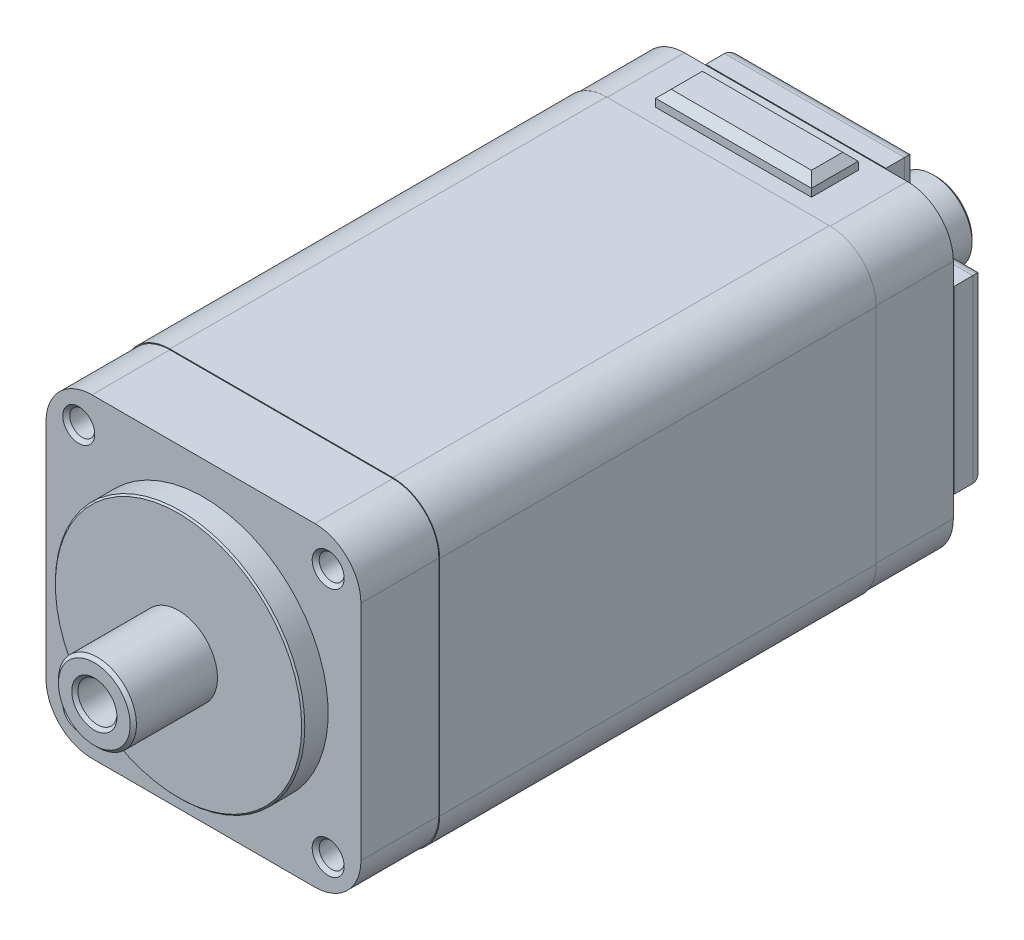
from build123d import *

# Parameters (mm, degrees)
MAIN_SKETCH_W                     = 38
MAIN_SKETCH_H                     = 20.3
MAIN_BODY_EXTRUDE_DEPTH           = 10.15
SKETCH2_R                         = 8
BOSS_EXTRUDE2_DEPTH               = 1.6
SKETCH3_R                         = 2.5
BOSS_EXTRUDE3_DEPTH               = 5.4
CUT_EXTRUDE1_DEPTH                = 48.233939069
CUT_EXTRUDE1_DEPTH_BACK           = 48.233939069
SKETCH4_R                         = 1.25
CHAMFER1_SIZE                     = 0.2
CHAMFER2_SIZE                     = 0.2
SKETCH6_R                         = 2.5
SKETCH6_R_2                       = 1.25
BOSS_EXTRUDE4_DEPTH               = 9
MOUNTING_HOLE_LOCATION_SKETCH_R   = 0.5
MOUNTING_HOLE_CUT_LOCATIONS_DEPTH = 2
CUT_EXTRUDE3_START                = -2
SKETCH8_R                         = 0.5
CUT_EXTRUDE3_DEPTH                = 2
FILLET1_R                         = 3
SKETCH10_R                        = 2.6
BOSS_EXTRUDE5_DEPTH               = 2
FILLET2_R                         = 0.8
SKETCH13_W                        = 10
SKETCH13_H                        = 3
BOSS_EXTRUDE7_DEPTH               = 1
CHAMFER3_SIZE                     = 0.5
CUT_EXTRUDE5_DEPTH                = 5
CUT_EXTRUDE6_START                = -5
CUT_EXTRUDE6_DEPTH                = 5
CHAMFER4_SIZE                     = 0.2
CHAMFER5_SIZE                     = 0.1


# Read off the part's stored shape, not the designer's step: M2 Tapped Hole1
with BuildPart() as part:
    # Main Sketch → Main Body Extrude (new, symmetric)
    with BuildSketch(Plane(origin=(0, 0, 0), x_dir=(0, 0, -1), z_dir=(1, 0, 0))):
        Rectangle(MAIN_SKETCH_W, MAIN_SKETCH_H)
    extrude(amount=MAIN_BODY_EXTRUDE_DEPTH, both=True)

    # Sketch2 → Boss-Extrude2 (add)
    with BuildSketch(Plane.XY.offset(19)):
        with Locations(Location((0, 0, 0), (0, 0, 180))):
            Circle(SKETCH2_R)
    extrude(amount=BOSS_EXTRUDE2_DEPTH)

    # Sketch3 → Boss-Extrude3 (add)
    with BuildSketch(Plane.XY.offset(20.6)):
        with Locations(Location((0, 0, 0), (0, 0, 180))):
            Circle(SKETCH3_R)
    extrude(amount=BOSS_EXTRUDE3_DEPTH)

    # Sketch4 → Cut-Extrude1 (cut, two sides: drawn at the far end of the back side and taken through both)
    with BuildSketch(Plane.XY.offset(26).offset(-CUT_EXTRUDE1_DEPTH_BACK)):
        Circle(SKETCH4_R)
    extrude(amount=CUT_EXTRUDE1_DEPTH + CUT_EXTRUDE1_DEPTH_BACK, mode=Mode.SUBTRACT)

    # Chamfer1
    chamfer1_edges = [part.edges().sort_by_distance(p)[0] for p in [
        (-1.25, 0, 26),
    ]]
    chamfer(chamfer1_edges, length=CHAMFER1_SIZE)

    # Chamfer2
    chamfer2_edges = [part.edges().sort_by_distance(p)[0] for p in [
        (2.5, 0, 26),
    ]]
    chamfer(chamfer2_edges, length=CHAMFER2_SIZE)

    # Sketch6 → Boss-Extrude4 (add)
    with BuildSketch(Plane(origin=(0, 0, -19), x_dir=(-1, 0, 0), z_dir=(0, 0, -1))):
        Circle(SKETCH6_R)
        with Locations(Location((0, 0, 0), (0, 0, 180))):
            Circle(SKETCH6_R_2, mode=Mode.SUBTRACT)
    extrude(amount=BOSS_EXTRUDE4_DEPTH)

    # Mounting Hole Location Sketch → Mounting Hole Cut Locations (cut)
    with BuildSketch(Plane.XY.offset(19)):
        with Locations((-8, 8)):
            Circle(MOUNTING_HOLE_LOCATION_SKETCH_R)
        with Locations((8, 8)):
            Circle(MOUNTING_HOLE_LOCATION_SKETCH_R)
        with Locations((8, -8)):
            Circle(MOUNTING_HOLE_LOCATION_SKETCH_R)
        with Locations((-8, -8)):
            Circle(MOUNTING_HOLE_LOCATION_SKETCH_R)
    extrude(amount=-MOUNTING_HOLE_CUT_LOCATIONS_DEPTH, mode=Mode.SUBTRACT)

    # Sketch8 → Cut-Extrude3 (cut)
    with BuildSketch(Plane(origin=(0, 0, -19), x_dir=(-1, 0, 0), z_dir=(0, 0, -1)).offset(CUT_EXTRUDE3_START)):
        with Locations(Location((8, -8, 0), (0, 0, 180))):
            Circle(SKETCH8_R)
        with Locations(Location((-8, -8, 0), (0, 0, 180))):
            Circle(SKETCH8_R)
        with Locations(Location((-8, 8, 0), (0, 0, 180))):
            Circle(SKETCH8_R)
        with Locations(Location((8, 8, 0), (0, 0, 180))):
            Circle(SKETCH8_R)
    extrude(amount=CUT_EXTRUDE3_DEPTH, mode=Mode.SUBTRACT)

    # M2 Tapped Hole1 outline → M2 Tapped Hole1 (revolve, cut)
    with BuildSketch(Plane(origin=(-8, 8, 0), x_dir=(1, 0, 0), z_dir=(0, -1, 0))):
        Polygon((0, -15.519311505), (0, -17), (0.5, -17), (0.5, -19), (1.025, -19), (0.8, -18.775), (0.8, -16), align=None)
        Polygon((0, 17), (0, 15.519311505), (0.8, 16), (0.8, 18.775), (1.025, 19), (0.5, 19), (0.5, 17), align=None)
    revolve(axis=Axis((-8, 8, 0), (0, 0, 1)), mode=Mode.SUBTRACT)

    # M2 Tapped Hole1 2 outline → M2 Tapped Hole1 2 (revolve, cut)
    with BuildSketch(Plane(origin=(8, -8, 0), x_dir=(1, 0, 0), z_dir=(0, -1, 0))):
        Polygon((0, -15.519311505), (0, -17), (0.5, -17), (0.5, -19), (1.025, -19), (0.8, -18.775), (0.8, -16), align=None)
        Polygon((0, 17), (0, 15.519311505), (0.8, 16), (0.8, 18.775), (1.025, 19), (0.5, 19), (0.5, 17), align=None)
    revolve(axis=Axis((8, -8, 0), (0, 0, 1)), mode=Mode.SUBTRACT)

    # M2 Tapped Hole1 3 outline → M2 Tapped Hole1 3 (revolve, cut)
    with BuildSketch(Plane(origin=(8, 8, 0), x_dir=(1, 0, 0), z_dir=(0, -1, 0))):
        Polygon((0, -15.519311505), (0, -17), (0.5, -17), (0.5, -19), (1.025, -19), (0.8, -18.775), (0.8, -16), align=None)
        Polygon((0, 17), (0, 15.519311505), (0.8, 16), (0.8, 18.775), (1.025, 19), (0.5, 19), (0.5, 17), align=None)
    revolve(axis=Axis((8, 8, 0), (0, 0, 1)), mode=Mode.SUBTRACT)

    # M2 Tapped Hole1 4 outline → M2 Tapped Hole1 4 (revolve, cut)
    with BuildSketch(Plane(origin=(-8, -8, 0), x_dir=(1, 0, 0), z_dir=(0, -1, 0))):
        Polygon((0, -15.519311505), (0, -17), (0.5, -17), (0.5, -19), (1.025, -19), (0.8, -18.775), (0.8, -16), align=None)
        Polygon((0, 17), (0, 15.519311505), (0.8, 16), (0.8, 18.775), (1.025, 19), (0.5, 19), (0.5, 17), align=None)
    revolve(axis=Axis((-8, -8, 0), (0, 0, 1)), mode=Mode.SUBTRACT)

    # Fillet1
    fillet1_edges = [part.edges().sort_by_distance(p)[0] for p in [
        (10.15, -10.15, 0),
        (-10.15, -10.15, 0),
        (-10.15, 10.15, 0),
        (10.15, 10.15, 0),
    ]]
    fillet(fillet1_edges, radius=FILLET1_R)

    # Sketch13 → Boss-Extrude7 (add)
    with BuildSketch(Plane(origin=(0, 10.15, 0), x_dir=(1, 0, 0), z_dir=(0, 1, 0))):
        with Locations((0, 16.5)):
            Rectangle(SKETCH13_W, SKETCH13_H)
    extrude(amount=BOSS_EXTRUDE7_DEPTH)

    # Chamfer3
    chamfer3_edges = [part.edges().sort_by_distance(p)[0] for p in [
        (-5, 11.15, -16.5),
        (0, 11.15, -15),
        (5, 11.15, -16.5),
        (0, 11.15, -18),
    ]]
    chamfer(chamfer3_edges, length=CHAMFER3_SIZE)

    # Sketch14 → Cut-Extrude5 (cut)
    with BuildSketch(Plane.XY.offset(19)):
        with BuildLine():
            Line((10.15, -7.15), (10.15, 7.15))
            ThreePointArc((10.15, 7.15), (9.271320344, 9.271320344), (7.15, 10.15))
            Line((7.15, 10.15), (-7.15, 10.15))
            ThreePointArc((-7.15, 10.15), (-9.271320344, 9.271320344), (-10.15, 7.15))
            Line((-10.15, 7.15), (-10.15, -7.15))
            ThreePointArc((-10.15, -7.15), (-9.271320344, -9.271320344), (-7.15, -10.15))
            Line((-7.15, -10.15), (7.15, -10.15))
            ThreePointArc((7.15, -10.15), (9.271320344, -9.271320344), (10.15, -7.15))
        make_face()
        with BuildLine():
            Line((10.1, -7.15), (10.1, 7.15))
            ThreePointArc((10.1, 7.15), (9.235965005, 9.235965005), (7.15, 10.1))
            Line((7.15, 10.1), (-7.15, 10.1))
            ThreePointArc((-7.15, 10.1), (-9.235965005, 9.235965005), (-10.1, 7.15))
            Line((-10.1, 7.15), (-10.1, -7.15))
            ThreePointArc((-10.1, -7.15), (-9.235965005, -9.235965005), (-7.15, -10.1))
            Line((-7.15, -10.1), (7.15, -10.1))
            ThreePointArc((7.15, -10.1), (9.235965005, -9.235965005), (10.1, -7.15))
        make_face(mode=Mode.SUBTRACT)
    extrude(amount=-CUT_EXTRUDE5_DEPTH, mode=Mode.SUBTRACT)

    # Sketch15 → Cut-Extrude6 (cut)
    with BuildSketch(Plane(origin=(0, 0, -19), x_dir=(-1, 0, 0), z_dir=(0, 0, -1)).offset(CUT_EXTRUDE6_START)):
        with BuildLine():
            Line((7.15, 10.15), (-7.15, 10.15))
            ThreePointArc((-7.15, 10.15), (-9.271320344, 9.271320344), (-10.15, 7.15))
            Line((-10.15, 7.15), (-10.15, -7.15))
            ThreePointArc((-10.15, -7.15), (-9.271320344, -9.271320344), (-7.15, -10.15))
            Line((-7.15, -10.15), (7.15, -10.15))
            ThreePointArc((7.15, -10.15), (9.271320344, -9.271320344), (10.15, -7.15))
            Line((10.15, -7.15), (10.15, 7.15))
            ThreePointArc((10.15, 7.15), (9.271320344, 9.271320344), (7.15, 10.15))
        make_face()
        with BuildLine():
            Line((-10.1, 7.15), (-10.1, -7.15))
            ThreePointArc((-10.1, -7.15), (-9.235965005, -9.235965005), (-7.15, -10.1))
            Line((-7.15, -10.1), (7.15, -10.1))
            ThreePointArc((7.15, -10.1), (9.235965005, -9.235965005), (10.1, -7.15))
            Line((10.1, -7.15), (10.1, 7.15))
            ThreePointArc((10.1, 7.15), (9.235965005, 9.235965005), (7.15, 10.1))
            Line((7.15, 10.1), (-7.15, 10.1))
            ThreePointArc((-7.15, 10.1), (-9.235965005, 9.235965005), (-10.1, 7.15))
        make_face(mode=Mode.SUBTRACT)
    extrude(amount=CUT_EXTRUDE6_DEPTH, mode=Mode.SUBTRACT)


with BuildPart() as body_2:
    # Sketch10 → Boss-Extrude5 (new body)
    with BuildSketch(Plane(origin=(0, 0, -19), x_dir=(-1, 0, 0), z_dir=(0, 0, -1))):
        with BuildLine():
            ThreePointArc((-5.775, 8), (-6.426687412, 6.426687412), (-8, 5.775))
            Line((-8, 5.775), (-10.15, 5.775))
            Line((-10.15, 5.775), (-10.15, -5.775))
            Line((-10.15, -5.775), (-8, -5.775))
            ThreePointArc((-8, -5.775), (-6.426687412, -6.426687412), (-5.775, -8))
            Line((-5.775, -8), (-5.775, -10.15))
            Line((-5.775, -10.15), (5.775, -10.15))
            Line((5.775, -10.15), (5.775, -8))
            ThreePointArc((5.775, -8), (6.426687412, -6.426687412), (8, -5.775))
            Line((8, -5.775), (10.15, -5.775))
            Line((10.15, -5.775), (10.15, 5.775))
            Line((10.15, 5.775), (8, 5.775))
            ThreePointArc((8, 5.775), (6.426687412, 6.426687412), (5.775, 8))
            Line((5.775, 8), (5.775, 10.15))
            Line((5.775, 10.15), (-5.775, 10.15))
            Line((-5.775, 10.15), (-5.775, 8))
        make_face()
        Circle(SKETCH10_R, mode=Mode.SUBTRACT)
    extrude(amount=BOSS_EXTRUDE5_DEPTH)

    # Fillet2
    fillet2_edges = [body_2.edges().sort_by_distance(p)[0] for p in [
        (-6.426687412, -6.426687412, -21),
        (-9.075, -5.775, -21),
        (-10.15, 0, -21),
        (-9.075, 5.775, -21),
        (-6.426687412, 6.426687412, -21),
        (-5.775, 9.075, -21),
        (0, 10.15, -21),
        (5.775, 9.075, -21),
        (6.426687412, 6.426687412, -21),
        (9.075, 5.775, -21),
        (10.15, 0, -21),
        (9.075, -5.775, -21),
        (6.426687412, -6.426687412, -21),
        (5.775, -9.075, -21),
        (0, -10.15, -21),
        (-5.775, -9.075, -21),
    ]]
    fillet(fillet2_edges, radius=FILLET2_R)


with BuildPart() as cut_extrude6_piece_1:
    # of the separate pieces the step leaves, piece 1, a body of its own (cut_extrude6_pieces)
    add(part.part.solids().sort_by_distance((-7.15, 10.15, -14))[0])

    # Chamfer4
    chamfer4_edges = [cut_extrude6_piece_1.edges().sort_by_distance(p)[0] for p in [
        (-1.25, 0, -28),
        (2.5, 0, -28),
    ]]
    chamfer(chamfer4_edges, length=CHAMFER4_SIZE)

    # Chamfer5
    chamfer5_edges = [cut_extrude6_piece_1.edges().sort_by_distance(p)[0] for p in [
        (8, 0, 20.6),
    ]]
    chamfer(chamfer5_edges, length=CHAMFER5_SIZE)


with BuildPart() as cut_extrude6_piece_2:
    # of the separate pieces the step leaves, piece 2, a body of its own (cut_extrude6_pieces)
    add(part.part.solids().sort_by_distance((5, 10.65, -18))[0])


solid = Compound([body_2.part, cut_extrude6_piece_1.part, cut_extrude6_piece_2.part])
